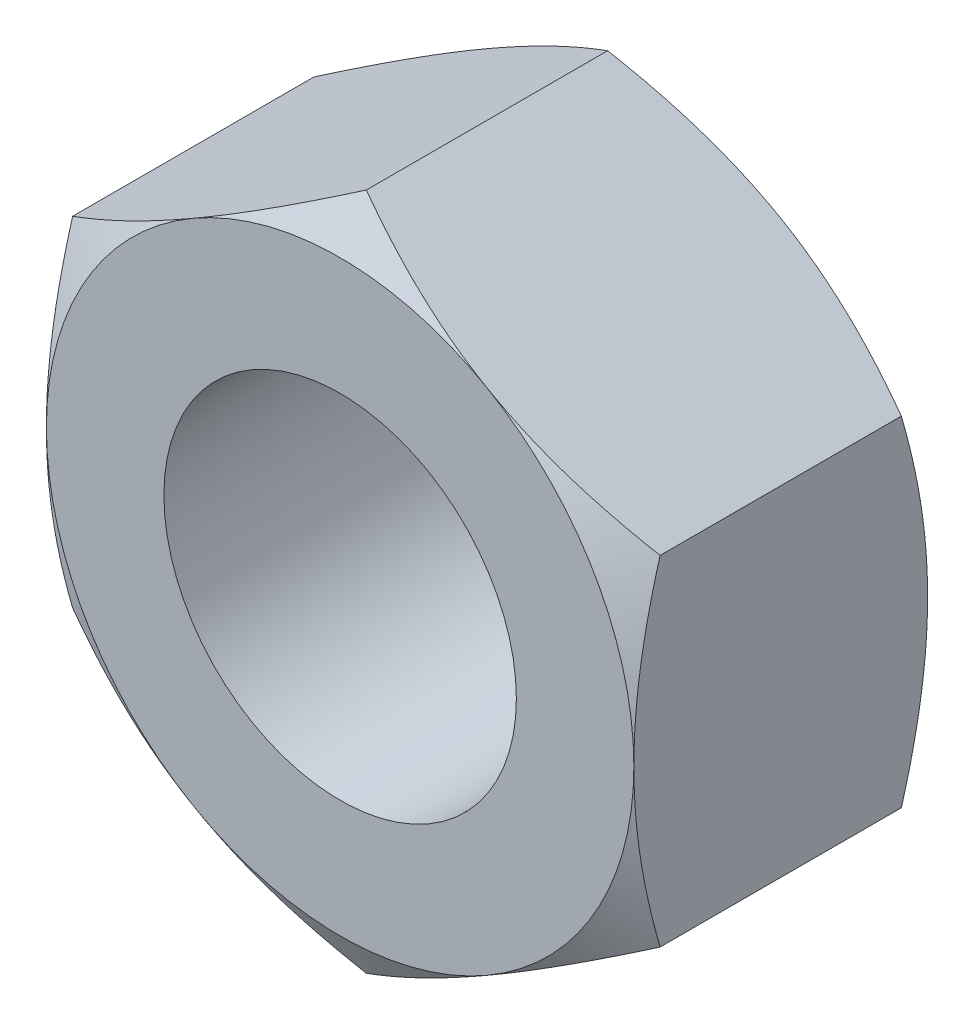
from build123d import *

# Parameters (mm, degrees)
BASE_EXTRUSION_DEPTH    = 5
ESQUISSE3_R             = 3
ENL_V_MAT_EXTRU_1_DEPTH = 10.128709292


with BuildPart() as part:
    # Esquisse1 → Base-Extrusion (new body)
    with BuildSketch(Plane.XY):
        Polygon((5, -2.886751346), (5, 2.886751346), (0, 5.773502692), (-5, 2.886751346), (-5, -2.886751346), (0, -5.773502692), align=None)
    extrude(amount=-BASE_EXTRUSION_DEPTH)

    # Esquisse2 → Enlèvement de matière-Révolution1 (revolve, cut)
    with BuildSketch(Plane(origin=(0, 0, 0), x_dir=(1, 0, 0), z_dir=(0, 1, 0))):
        Polygon((-5, 0), (-10.330127019, 0), (-10.330127019, 5), (-5, 5), (-9.330127019, 2.5), align=None)
    revolve(axis=Axis((0, 0, -5), (0, 0, 1)), mode=Mode.SUBTRACT)

    # Esquisse3 → Enlèv. mat.-Extru.1 (cut, through all)
    with BuildSketch(Plane.XY):
        Circle(ESQUISSE3_R)
    extrude(amount=-ENL_V_MAT_EXTRU_1_DEPTH, mode=Mode.SUBTRACT)


solid = part.part
